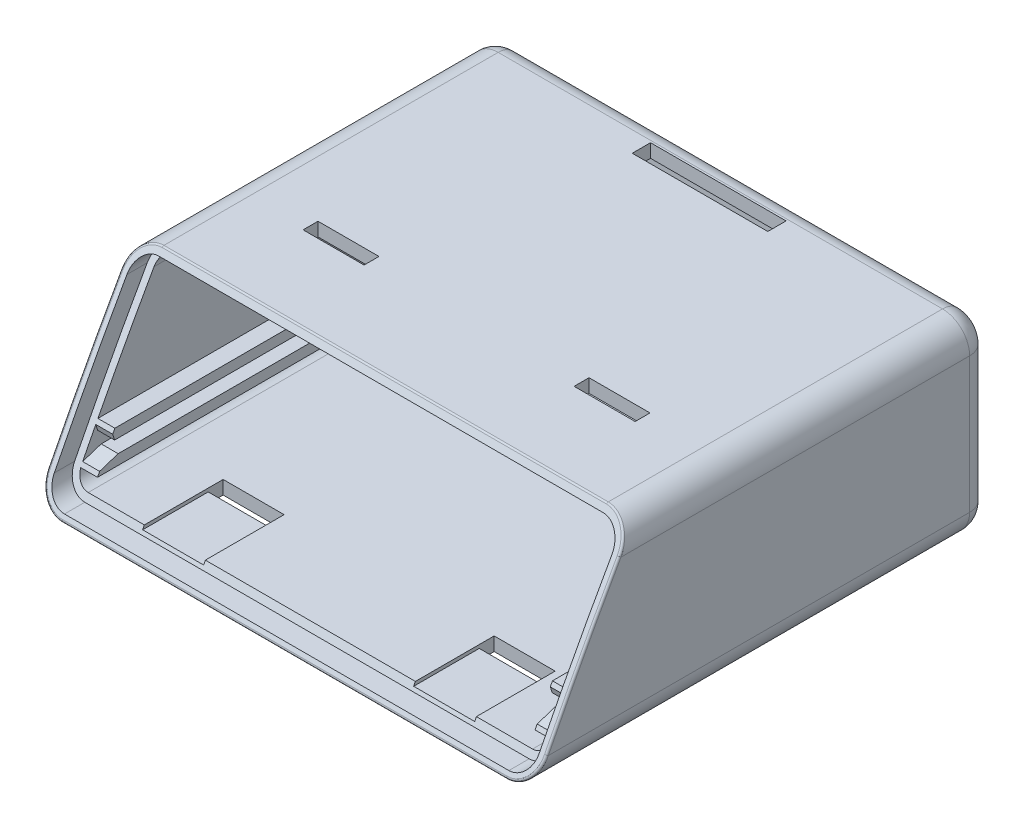
from build123d import *
from OCP.BRepAlgoAPI import BRepAlgoAPI_Cut
from OCP.TopTools import TopTools_ListOfShape

# Parameters (mm, degrees)
SKETCH1_W                = 73.58
SKETCH1_H                = 67.5
BOSS_EXTRUDE1_DEPTH      = 28
FILLET1_R                = 4
SHELL1_T                 = -2
CUT_EXTRUDE1_DEPTH       = 86.656750464
FILLET2_R                = 3
CUT_EXTRUDE3_REACH       = 162.173
CUT_EXTRUDE3_END_RADIUS  = 475
CUT_EXTRUDE3_START       = 80
FILLET3_R                = 0.3
BOSS_EXTRUDE2_REACH      = 82.024
BOSS_EXTRUDE2_END_RADIUS = 475
SKETCH5_W                = 2.5
SKETCH5_H                = 1.5
SKETCH6_W                = 14.3
SKETCH6_H                = 16.7
SKETCH6_W_2              = 11.05
SKETCH6_H_2              = 14.049996967
CUT_EXTRUDE4_DEPTH       = 2
SKETCH7_W                = 9
SKETCH7_H                = 2.2
CUT_EXTRUDE5_DEPTH       = 2
SKETCH11_W               = 9
SKETCH11_H               = 2.2
CUT_EXTRUDE8_DEPTH       = 2
SKETCH8_W                = 20
SKETCH8_H                = 2.4
CUT_EXTRUDE6_DEPTH       = 2
SKETCH14_W               = 9
SKETCH14_H               = 0.5
CUT_EXTRUDE11_DEPTH      = 72.148851239
SKETCH12_W               = 9
SKETCH12_H               = 0.5
CUT_EXTRUDE9_DEPTH       = 62.187502915
SKETCH10_W               = 13.75
SKETCH10_H               = 1.6
SKETCH10_W_2             = 27.64
SKETCH10_H_2             = 2
SKETCH10_W_3             = 2.84
BOSS_EXTRUDE3_DEPTH      = 0.5
CHAMFER1_START           = -34.79
CHAMFER1_DEPTH           = 69.58
SKETCH13_W               = 20
SKETCH13_H               = 2
CUT_EXTRUDE10_DEPTH      = 0.3


with BuildPart() as part:
    # Sketch1 → Boss-Extrude1 (new body)
    with BuildSketch(Plane(origin=(0, 0, 0), x_dir=(1, 0, 0), z_dir=(0, 1, 0))):
        Rectangle(SKETCH1_W, SKETCH1_H)
    extrude(amount=BOSS_EXTRUDE1_DEPTH)

    # Fillet1
    fillet1_edges = [part.edges().sort_by_distance(p)[0] for p in [
        (-36.79, 28, 0),
        (36.79, 28, 0),
        (-36.79, 0, 0),
        (36.79, 0, 0),
    ]]
    fillet(fillet1_edges, radius=FILLET1_R)

    # Shell1
    shell1_openings = [part.faces().sort_by_distance(p)[0] for p in [
        (0, 14, 33.75),
    ]]
    offset(amount=SHELL1_T, openings=shell1_openings, kind=Kind.INTERSECTION)


with BuildPart() as cut_extrude1_tool:
    # Sketch2 → Cut-Extrude1 (new, through all)
    with BuildSketch(Plane.ZY.offset(36.79)):
        with BuildLine():
            Line((18.75, 28), (33.75, 28))
            Line((33.75, 28), (33.75, 0))
            ThreePointArc((33.75, 0), (26.484121584, 14.125422277), (18.75, 28))
        make_face()
    extrude(amount=-CUT_EXTRUDE1_DEPTH)


with BuildPart() as part_1:
    add(part.part)

    # Cut-Extrude1: cut by cut_extrude1_tool, with a tolerance
    cut_extrude1_stock = TopTools_ListOfShape()
    cut_extrude1_stock.Append(part_1.part.wrapped)
    cut_extrude1_tools = TopTools_ListOfShape()
    cut_extrude1_tools.Append(cut_extrude1_tool.part.wrapped)
    cut_extrude1_cut = BRepAlgoAPI_Cut()
    cut_extrude1_cut.SetArguments(cut_extrude1_stock)
    cut_extrude1_cut.SetTools(cut_extrude1_tools)
    cut_extrude1_cut.SetFuzzyValue(0.00001)
    cut_extrude1_cut.Build()
    add(Compound.cast(cut_extrude1_cut.Shape()).solids(), mode=Mode.REPLACE)

    # Fillet2
    fillet2_edges = [part_1.edges().sort_by_distance(p)[0] for p in [
        (0, 28, -33.75),
        (0, 0, -33.75),
        (-36.79, 14, -33.75),
        (36.79, 14, -33.75),
        (-35.618427125, 26.828427125, -33.75),
        (-35.618427125, 1.171572875, -33.75),
        (35.618427125, 1.171572875, -33.75),
        (35.618427125, 26.828427125, -33.75),
    ]]
    fillet(fillet2_edges, radius=FILLET2_R)

    # Cut-Extrude3: up to this cylinder (the profile starts outside it)
    cut_extrude3_end = Plane(origin=(0, -210.179748667, -395.218864179), z_dir=(-1, 0, 0)) * Cylinder(CUT_EXTRUDE3_END_RADIUS, 1275.346, mode=Mode.PRIVATE)
    # Sketch4 → Cut-Extrude3 (cut, up to the surface)
    with BuildSketch(Plane.XY.offset(-31.75).offset(CUT_EXTRUDE3_START), mode=Mode.PRIVATE) as cut_extrude3_sk1:
        with BuildLine():
            Line((32.79, 27), (-32.79, 27))
            ThreePointArc((-32.79, 27), (-34.911320344, 26.121320344), (-35.79, 24))
            Line((-35.79, 24), (-35.79, 4))
            ThreePointArc((-35.79, 4), (-34.911320344, 1.878679656), (-32.79, 1))
            Line((-32.79, 1), (32.79, 1))
            ThreePointArc((32.79, 1), (34.911320344, 1.878679656), (35.79, 4))
            Line((35.79, 4), (35.79, 24))
            ThreePointArc((35.79, 24), (34.911320344, 26.121320344), (32.79, 27))
        make_face()
        with BuildLine():
            Line((32.79, 26), (-32.79, 26))
            ThreePointArc((-32.79, 26), (-34.204213562, 25.414213562), (-34.79, 24))
            Line((-34.79, 24), (-34.79, 4))
            ThreePointArc((-34.79, 4), (-34.204213562, 2.585786438), (-32.79, 2))
            Line((-32.79, 2), (32.79, 2))
            ThreePointArc((32.79, 2), (34.204213562, 2.585786438), (34.79, 4))
            Line((34.79, 4), (34.79, 24))
            ThreePointArc((34.79, 24), (34.204213562, 25.414213562), (32.79, 26))
        make_face(mode=Mode.SUBTRACT)
    cut_extrude3_tool1 = extrude(cut_extrude3_sk1.sketch, amount=-CUT_EXTRUDE3_REACH, mode=Mode.PRIVATE) - cut_extrude3_end
    add(cut_extrude3_tool1.solids().sort_by_distance((0, 26.238443, 48.25))[0], mode=Mode.SUBTRACT)

    # Fillet3
    fillet3_edges = [part_1.edges().sort_by_distance(p)[0] for p in [
        (0, 0, 33.75),
        (-36.79, 14.0639546, 26.517044891),
        (35.714985447, 26.728453829, 19.484309952),
        (35.696759777, 1.252137621, 33.12988385),
        (-35.696759776, 1.252137622, 33.12988385),
        (-35.714985447, 26.728453829, 19.484309952),
        (36.79, 14.0639546, 26.517044891),
        (0, 28, 18.75),
    ]]
    fillet(fillet3_edges, radius=FILLET3_R)

    # Boss-Extrude2: up to this cylinder (the profile starts inside it)
    boss_extrude2_end = Plane(origin=(0, -210.179748667, -395.218864179), z_dir=(-1, 0, 0)) * Cylinder(BOSS_EXTRUDE2_END_RADIUS, 1182.128, mode=Mode.PRIVATE)
    # Sketch5 → Boss-Extrude2 (add, up to the surface)
    with BuildSketch(Plane.XY.offset(-31.75), mode=Mode.PRIVATE) as boss_extrude2_sk1:
        with Locations((33.54, 4.5)):
            Rectangle(SKETCH5_W, SKETCH5_H)
    boss_extrude2_tool1 = extrude(boss_extrude2_sk1.sketch, amount=BOSS_EXTRUDE2_REACH, mode=Mode.PRIVATE) & boss_extrude2_end
    add(boss_extrude2_tool1.solids().sort_by_distance((33.54, 4.5, -31.75))[0])
    # Sketch5 → Boss-Extrude2 (add, up to the surface)
    with BuildSketch(Plane.XY.offset(-31.75), mode=Mode.PRIVATE) as boss_extrude2_sk2:
        with Locations((33.54, 8)):
            Rectangle(SKETCH5_W, SKETCH5_H)
    boss_extrude2_tool2 = extrude(boss_extrude2_sk2.sketch, amount=BOSS_EXTRUDE2_REACH, mode=Mode.PRIVATE) & boss_extrude2_end
    add(boss_extrude2_tool2.solids().sort_by_distance((33.54, 8, -31.75))[0])
    # Sketch5 → Boss-Extrude2 (add, up to the surface)
    with BuildSketch(Plane.XY.offset(-31.75), mode=Mode.PRIVATE) as boss_extrude2_sk3:
        with Locations((-33.54, 8)):
            Rectangle(SKETCH5_W, SKETCH5_H)
    boss_extrude2_tool3 = extrude(boss_extrude2_sk3.sketch, amount=BOSS_EXTRUDE2_REACH, mode=Mode.PRIVATE) & boss_extrude2_end
    add(boss_extrude2_tool3.solids().sort_by_distance((-33.54, 8, -31.75))[0])
    # Sketch5 → Boss-Extrude2 (add, up to the surface)
    with BuildSketch(Plane.XY.offset(-31.75), mode=Mode.PRIVATE) as boss_extrude2_sk4:
        with Locations((-33.54, 4.5)):
            Rectangle(SKETCH5_W, SKETCH5_H)
    boss_extrude2_tool4 = extrude(boss_extrude2_sk4.sketch, amount=BOSS_EXTRUDE2_REACH, mode=Mode.PRIVATE) & boss_extrude2_end
    add(boss_extrude2_tool4.solids().sort_by_distance((-33.54, 4.5, -31.75))[0])

    # Sketch6 → Cut-Extrude4 (cut)
    with BuildSketch(Plane(origin=(0, 0, -33.75), x_dir=(-1, 0, 0), z_dir=(0, 0, -1))):
        with Locations((0, 10.35)):
            Rectangle(SKETCH6_W, SKETCH6_H)
        with Locations((26.425, 10.175001517)):
            Rectangle(SKETCH6_W_2, SKETCH6_H_2)
    extrude(amount=-CUT_EXTRUDE4_DEPTH, mode=Mode.SUBTRACT)

    # Sketch7 → Cut-Extrude5 (cut)
    with BuildSketch(Plane(origin=(0, 28, 0), x_dir=(1, 0, 0), z_dir=(0, 1, 0))):
        with Locations((-20, -5.23)):
            Rectangle(SKETCH7_W, SKETCH7_H)
        with Locations((20, -5.23)):
            Rectangle(SKETCH7_W, SKETCH7_H)
    extrude(amount=-CUT_EXTRUDE5_DEPTH, mode=Mode.SUBTRACT)

    # Sketch11 → Cut-Extrude8 (cut)
    with BuildSketch(Plane.XZ):
        with Locations((-20, 19.230078769)):
            Rectangle(SKETCH11_W, SKETCH11_H)
        with Locations((20, 19.230078769)):
            Rectangle(SKETCH11_W, SKETCH11_H)
    extrude(amount=-CUT_EXTRUDE8_DEPTH, mode=Mode.SUBTRACT)

    # Sketch8 → Cut-Extrude6 (cut)
    with BuildSketch(Plane(origin=(0, 28, 0), x_dir=(1, 0, 0), z_dir=(0, 1, 0))):
        with Locations((0, 28.95)):
            Rectangle(SKETCH8_W, SKETCH8_H)
    extrude(amount=-CUT_EXTRUDE6_DEPTH, mode=Mode.SUBTRACT)

    # Sketch14 → Cut-Extrude11 (cut, through all)
    with BuildSketch(Plane(origin=(0, 0, 20.330078769), x_dir=(-1, 0, 0), z_dir=(0, 0, -1))):
        with Locations((-20, 1.75)):
            Rectangle(SKETCH14_W, SKETCH14_H)
        with Locations((20, 1.75)):
            Rectangle(SKETCH14_W, SKETCH14_H)
    extrude(amount=-CUT_EXTRUDE11_DEPTH, mode=Mode.SUBTRACT)

    # Sketch12 → Cut-Extrude9 (cut, through all)
    with BuildSketch(Plane(origin=(0, 0, 6.33), x_dir=(-1, 0, 0), z_dir=(0, 0, -1))):
        with Locations((20, 26.25)):
            Rectangle(SKETCH12_W, SKETCH12_H)
        with Locations((-20, 26.25)):
            Rectangle(SKETCH12_W, SKETCH12_H)
    extrude(amount=-CUT_EXTRUDE9_DEPTH, mode=Mode.SUBTRACT)

    # Sketch10 → Boss-Extrude3 (add)
    with BuildSketch(Plane.XY.offset(-31.75)):
        with Locations((-14.025, 6.25)):
            Rectangle(SKETCH10_W, SKETCH10_H)
        with Locations((20.97, 6.25)):
            Rectangle(SKETCH10_W_2, SKETCH10_H_2)
        with Locations((-33.37, 6.25)):
            Rectangle(SKETCH10_W_3, SKETCH10_H_2)
    extrude(amount=BOSS_EXTRUDE3_DEPTH)

    # Chamfer1: read off the stored shape, not the designer's step
    # Chamfer1 outline → Chamfer1 (cut)
    with BuildSketch(Plane.YZ.offset(CHAMFER1_START)):
        with BuildLine():
            ThreePointArc((8.137667838, 26.63716061), (7.693954372, 26.866493923), (7.25, 27.095360533))
            Line((7.25, 27.095360533), (7.25, 26.352876009))
            Line((7.25, 26.352876009), (8.137667838, 26.63716061))
        make_face()
        with BuildLine():
            Line((4.359221973, 28.571213662), (5.25, 25.834427816))
            Line((5.25, 25.834427816), (5.25, 28.11908993))
            ThreePointArc((5.25, 28.11908993), (4.804729842, 28.345385965), (4.359221973, 28.571213662))
        make_face()
    extrude(amount=CHAMFER1_DEPTH, mode=Mode.SUBTRACT)

    # Sketch13 → Cut-Extrude10 (cut)
    with BuildSketch(Plane.XY.offset(-30.15)):
        with Locations((0, 27)):
            Rectangle(SKETCH13_W, SKETCH13_H)
    extrude(amount=-CUT_EXTRUDE10_DEPTH, mode=Mode.SUBTRACT)


solid = part_1.part
